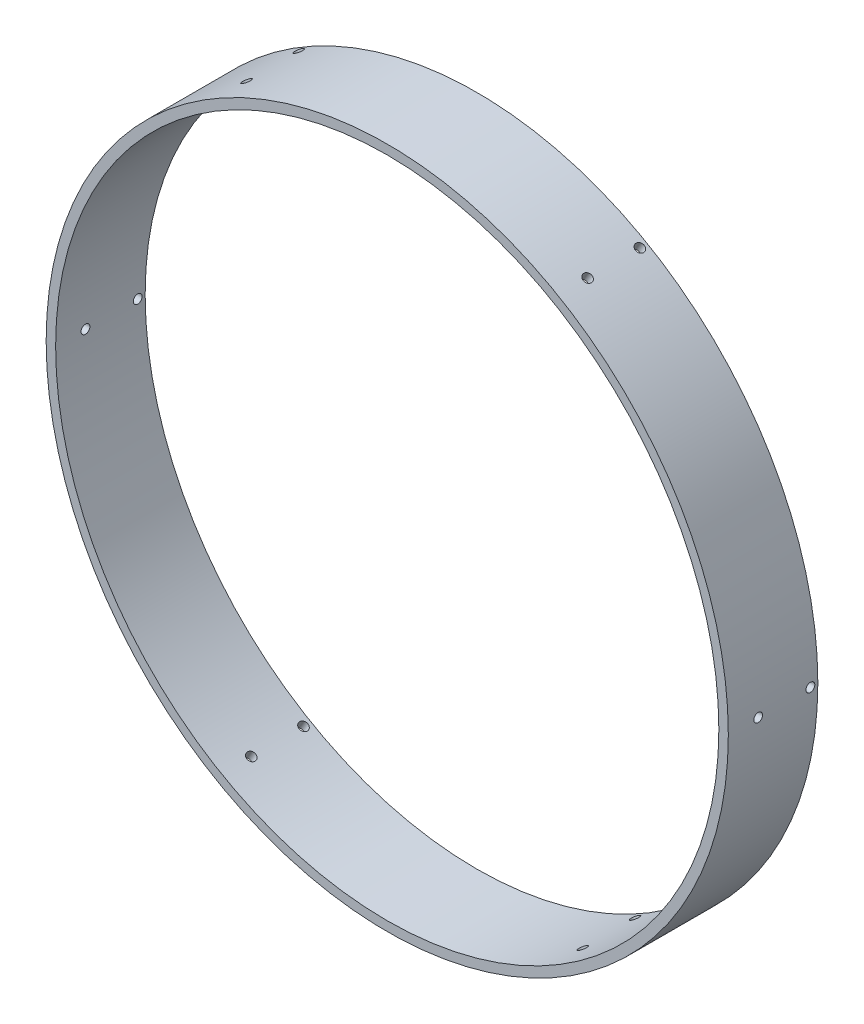
from build123d import *

# Parameters (mm, degrees)
SKETCH1_R               = 114.3
SKETCH1_R_2             = 107.95
BOSS_EXTRUDE1_DEPTH     = 320
SKETCH2_R               = 1.4732
CUT_EXTRUDE1_DEPTH      = 410.539314352
CIRPATTERN1_COUNT       = 3
CUT_EXTRUDE2_START      = -39.999999916
SKETCH3_R               = 111.125
SKETCH3_R_2             = 107.95
CUT_EXTRUDE2_DEPTH      = 39.999999916
SKETCH4_R               = 111.125
SKETCH4_R_2             = 107.95
CUT_EXTRUDE3_DEPTH      = 10.000000038
SKETCH6_R               = 1.4732
CUT_EXTRUDE4_DEPTH      = 10
SKETCH7_R               = 1.4732
CUT_EXTRUDE5_DEPTH      = 10
CIRPATTERN3_COUNT       = 3
SKETCH8_R               = 1.4732
CUT_EXTRUDE6_DEPTH      = 10
CIRPATTERN4_COUNT       = 3
CUT_EXTRUDE7_DEPTH      = 359.509386362
CUT_EXTRUDE7_DEPTH_BACK = 359.509386362
SKETCH9_W               = 290
SKETCH9_H               = 228.6


with BuildPart() as part:
    # Sketch1 → Boss-Extrude1 (new body)
    with BuildSketch(Plane.XY):
        Circle(SKETCH1_R)
        Circle(SKETCH1_R_2, mode=Mode.SUBTRACT)
    extrude(amount=BOSS_EXTRUDE1_DEPTH)

    # Sketch2 → Cut-Extrude1 (cut, through all)
    with BuildSketch(Plane.ZY.offset(114.3)):
        with Locations((2.5, 0)):
            Circle(SKETCH2_R)
        with Locations((310, 0)):
            Circle(SKETCH2_R)
        with Locations((292.5, 0)):
            Circle(SKETCH2_R)
    cut_extrude1 = extrude(amount=-CUT_EXTRUDE1_DEPTH, mode=Mode.SUBTRACT)

    # CirPattern1: Cut-Extrude1 ×3 about axis
    cirpattern1_axis = Axis((0, 0, 320), (0, 0, -1))
    for i in range(1, CIRPATTERN1_COUNT):
        add(cut_extrude1.rotate(cirpattern1_axis, i * 360 / CIRPATTERN1_COUNT), mode=Mode.SUBTRACT)

    # Sketch3 → Cut-Extrude2 (cut)
    with BuildSketch(Plane.XY.offset(320).offset(CUT_EXTRUDE2_START)):
        Circle(SKETCH3_R)
        Circle(SKETCH3_R_2, mode=Mode.SUBTRACT)
    extrude(amount=CUT_EXTRUDE2_DEPTH, mode=Mode.SUBTRACT)

    # Sketch4 → Cut-Extrude3 (cut)
    with BuildSketch(Plane(origin=(0, 0, 0), x_dir=(-1, 0, 0), z_dir=(0, 0, -1))):
        Circle(SKETCH4_R)
        Circle(SKETCH4_R_2, mode=Mode.SUBTRACT)
    extrude(amount=-CUT_EXTRUDE3_DEPTH, mode=Mode.SUBTRACT)

    # Sketch6 → Cut-Extrude4 (cut)
    with BuildSketch(Plane(origin=(-113.865053992, 9.961901396, 0), x_dir=(0, 0, 1), z_dir=(-0.9961946980917455, 0.08715574274765836, 0))):
        with Locations((260.79, 0)):
            Circle(SKETCH6_R)
    cut_extrude4 = extrude(amount=-CUT_EXTRUDE4_DEPTH, mode=Mode.SUBTRACT)

    # Sketch7 → Cut-Extrude5 (cut)
    with BuildSketch(Plane(origin=(-113.865053992, -9.961901396, 0), x_dir=(0, 0, 1), z_dir=(-0.9961946980917455, -0.08715574274765839, 0))):
        with Locations((260.79, 0)):
            Circle(SKETCH7_R)
    cut_extrude5 = extrude(amount=-CUT_EXTRUDE5_DEPTH, mode=Mode.SUBTRACT)

    # CirPattern3: Cut-Extrude4, Cut-Extrude5 ×3 about axis
    cirpattern3_axis = Axis((0, 0, 320), (0, 0, -1))
    add([cut_extrude4.rotate(cirpattern3_axis, i * 360 / CIRPATTERN3_COUNT) for i in range(1, CIRPATTERN3_COUNT)], mode=Mode.SUBTRACT)
    add([cut_extrude5.rotate(cirpattern3_axis, i * 360 / CIRPATTERN3_COUNT) for i in range(1, CIRPATTERN3_COUNT)], mode=Mode.SUBTRACT)

    # Sketch8 → Cut-Extrude6 (cut)
    with BuildSketch(Plane(origin=(-57.15, 98.986703653, 0), x_dir=(0, 0, 1), z_dir=(-0.499999999999998, 0.8660254037844398, 0))):
        with Locations((20, 0)):
            Circle(SKETCH8_R)
        with Locations((259.803, 0)):
            Circle(SKETCH8_R)
    cut_extrude6 = extrude(amount=-CUT_EXTRUDE6_DEPTH, mode=Mode.SUBTRACT)

    # CirPattern4: Cut-Extrude6 ×3 about axis
    cirpattern4_axis = Axis((0, 0, 320), (0, 0, -1))
    for i in range(1, CIRPATTERN4_COUNT):
        add(cut_extrude6.rotate(cirpattern4_axis, i * 360 / CIRPATTERN4_COUNT), mode=Mode.SUBTRACT)

    # Sketch9 → Cut-Extrude7 (cut, two sides: drawn at the far end of the back side and taken through both)
    with BuildSketch(Plane(origin=(0, 0, 0), x_dir=(0, 0, -1), z_dir=(1, 0, 0)).offset(-CUT_EXTRUDE7_DEPTH_BACK)):
        with Locations((-145, 0)):
            Rectangle(SKETCH9_W, SKETCH9_H)
    extrude(amount=CUT_EXTRUDE7_DEPTH + CUT_EXTRUDE7_DEPTH_BACK, mode=Mode.SUBTRACT)


solid = part.part
